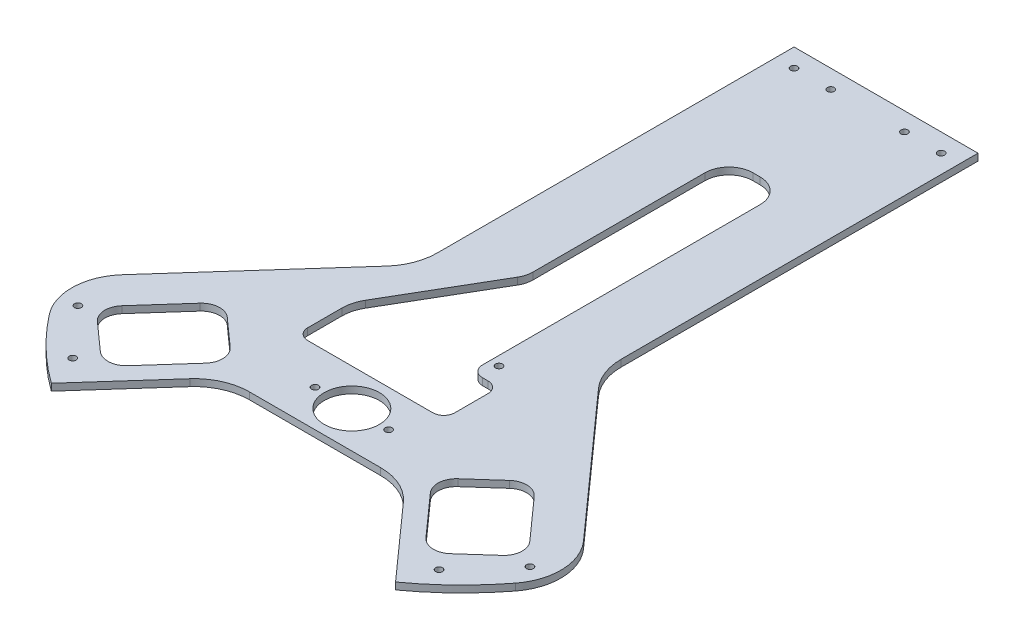
from build123d import *

# Parameters (mm, degrees)
SKETCH1_R           = 2.38125
BOSS_EXTRUDE1_DEPTH = 4.7625
SKETCH2_R           = 2.38125
CUT_EXTRUDE1_DEPTH  = 343.797654481
FILLET1_R           = 38.1
SKETCH4_R           = 2.38125
CUT_EXTRUDE3_DEPTH  = 343.797654481
FILLET2_R           = 38.1
CUT_EXTRUDE4_DEPTH  = 338.871506933
FILLET3_R           = 12.7
SKETCH6_R           = 19.05
CUT_EXTRUDE5_DEPTH  = 338.871506933
SKETCH7_W           = 38.1
SKETCH7_H           = 254
CUT_EXTRUDE6_DEPTH  = 338.871506933
SKETCH8_W           = 101.6
SKETCH8_H           = 38.1
CUT_EXTRUDE7_DEPTH  = 338.871506933
CUT_EXTRUDE8_DEPTH  = 338.871506933
FILLET4_R           = 25.4
FILLET5_R           = 7.62
FILLET8_R           = 16.51


with BuildPart() as part:
    # Sketch1 → Boss-Extrude1 (new body)
    with BuildSketch(Plane(origin=(0, 0, 0), x_dir=(1, 0, 0), z_dir=(0, 1, 0))):
        with BuildLine():
            Line((63.5, 31.75), (63.5, 292.608))
            Line((63.5, 292.608), (-63.5, 292.608))
            Line((-63.5, 292.608), (-63.5, 31.75))
            Line((-63.5, 31.75), (-178.516410583, -97.067662754))
            ThreePointArc((-178.516410583, -97.067662754), (-152.483723292, -134.309173667), (-118.826410583, -164.834838999))
            Line((-118.826410583, -164.834838999), (-62.366418607, -101.6))
            Line((-62.366418607, -101.6), (62.366418607, -101.6))
            Line((62.366418607, -101.6), (118.826410583, -164.834838999))
            ThreePointArc((118.826410583, -164.834838999), (152.483723292, -134.309173667), (178.516410583, -97.067662754))
            Line((178.516410583, -97.067662754), (63.5, 31.75))
        make_face()
        with Locations((-25.4, 0)):
            Circle(SKETCH1_R, mode=Mode.SUBTRACT)
        with Locations((25.4, 0)):
            Circle(SKETCH1_R, mode=Mode.SUBTRACT)
        with Locations((25.4, -76.2)):
            Circle(SKETCH1_R, mode=Mode.SUBTRACT)
        with Locations((-25.4, -76.2)):
            Circle(SKETCH1_R, mode=Mode.SUBTRACT)
    extrude(amount=BOSS_EXTRUDE1_DEPTH)

    # Sketch2 → Cut-Extrude1 (cut, through all)
    with BuildSketch(Plane(origin=(0, 4.7625, 0), x_dir=(1, 0, 0), z_dir=(0, 1, 0))):
        with Locations((25.4, 279.908)):
            Circle(SKETCH2_R)
        with Locations((50.8, 279.908)):
            Circle(SKETCH2_R)
        with Locations((-50.8, 279.908)):
            Circle(SKETCH2_R)
        with Locations((-25.4, 279.908)):
            Circle(SKETCH2_R)
    extrude(amount=-CUT_EXTRUDE1_DEPTH, mode=Mode.SUBTRACT)

    # Fillet1
    fillet1_edges = [part.edges().sort_by_distance(p)[0] for p in [
        (63.5, 2.38125, -31.75),
        (-63.5, 2.38125, -31.75),
        (62.366418607, 2.38125, 101.6),
        (-62.366418607, 2.38125, 101.6),
    ]]
    fillet(fillet1_edges, radius=FILLET1_R)

    # Sketch4 → Cut-Extrude3 (cut, through all)
    with BuildSketch(Plane(origin=(0, 4.7625, 0), x_dir=(1, 0, 0), z_dir=(0, 1, 0))):
        with Locations((-156.048464437, -109.266311125)):
            Circle(SKETCH4_R)
        with Locations((-126.479111192, -142.454499515)):
            Circle(SKETCH4_R)
        with Locations((126.479111192, -142.454499515)):
            Circle(SKETCH4_R)
        with Locations((156.048464437, -109.266311125)):
            Circle(SKETCH4_R)
    extrude(amount=-CUT_EXTRUDE3_DEPTH, mode=Mode.SUBTRACT)

    # Fillet2
    fillet2_edges = [part.edges().sort_by_distance(p)[0] for p in [
        (178.516410583, 2.38125, 97.067662754),
        (-178.516410583, 2.38125, 97.067662754),
    ]]
    fillet(fillet2_edges, radius=FILLET2_R)

    # Sketch5 → Cut-Extrude4 (cut, through all)
    with BuildSketch(Plane(origin=(0, 4.7625, 0), x_dir=(1, 0, 0), z_dir=(0, 1, 0))):
        Polygon((-149.276482194, -103.59593683), (-111.382942554, -137.429642709), (-69.090810204, -90.062718159), (-106.984349844, -56.22901228), align=None)
        Polygon((106.984349844, -56.22901228), (69.090810204, -90.062718159), (111.382942554, -137.429642709), (149.276482194, -103.59593683), align=None)
    extrude(amount=-CUT_EXTRUDE4_DEPTH, mode=Mode.SUBTRACT)

    # Fillet3
    fillet3_edges = [part.edges().sort_by_distance(p)[0] for p in [
        (111.382942554, 2.38125, 137.429642709),
        (69.090810204, 2.38125, 90.062718159),
        (106.984349844, 2.38125, 56.22901228),
        (149.276482194, 2.38125, 103.59593683),
        (-69.090810204, 2.38125, 90.062718159),
        (-106.984349844, 2.38125, 56.22901228),
        (-149.276482194, 2.38125, 103.59593683),
        (-111.382942554, 2.38125, 137.429642709),
    ]]
    fillet(fillet3_edges, radius=FILLET3_R)

    # Sketch6 → Cut-Extrude5 (cut, through all)
    with BuildSketch(Plane(origin=(0, 4.7625, 0), x_dir=(1, 0, 0), z_dir=(0, 1, 0))):
        with Locations((0, -76.2)):
            Circle(SKETCH6_R)
    extrude(amount=-CUT_EXTRUDE5_DEPTH, mode=Mode.SUBTRACT)

    # Sketch7 → Cut-Extrude6 (cut, through all)
    with BuildSketch(Plane(origin=(0, 4.7625, 0), x_dir=(1, 0, 0), z_dir=(0, 1, 0))):
        with Locations((0, 76.2)):
            Rectangle(SKETCH7_W, SKETCH7_H)
    extrude(amount=-CUT_EXTRUDE6_DEPTH, mode=Mode.SUBTRACT)

    # Sketch8 → Cut-Extrude7 (cut, through all)
    with BuildSketch(Plane(origin=(0, 4.7625, 0), x_dir=(1, 0, 0), z_dir=(0, 1, 0))):
        with Locations((-12.7, -31.75)):
            Rectangle(SKETCH8_W, SKETCH8_H)
    extrude(amount=-CUT_EXTRUDE7_DEPTH, mode=Mode.SUBTRACT)

    # Sketch9 → Cut-Extrude8 (cut, through all)
    with BuildSketch(Plane(origin=(0, 4.7625, 0), x_dir=(1, 0, 0), z_dir=(0, 1, 0))):
        Polygon((-63.5, -12.7), (-19.05, 63.5), (-19.05, -12.7), align=None)
    extrude(amount=-CUT_EXTRUDE8_DEPTH, mode=Mode.SUBTRACT)

    # Fillet4
    fillet4_edges = [part.edges().sort_by_distance(p)[0] for p in [
        (-63.5, 2.38125, 12.7),
    ]]
    fillet(fillet4_edges, radius=FILLET4_R)

    # Fillet5
    fillet5_edges = [part.edges().sort_by_distance(p)[0] for p in [
        (-63.5, 2.38125, 50.8),
        (38.1, 2.38125, 50.8),
        (38.1, 2.38125, 12.7),
        (19.05, 2.38125, 12.7),
    ]]
    fillet(fillet5_edges, radius=FILLET5_R)

    # Fillet8
    fillet8_edges = [part.edges().sort_by_distance(p)[0] for p in [
        (-19.05, 2.38125, -203.2),
        (19.05, 2.38125, -203.2),
        (-19.05, 2.38125, -63.5),
    ]]
    fillet(fillet8_edges, radius=FILLET8_R)


solid = part.part
